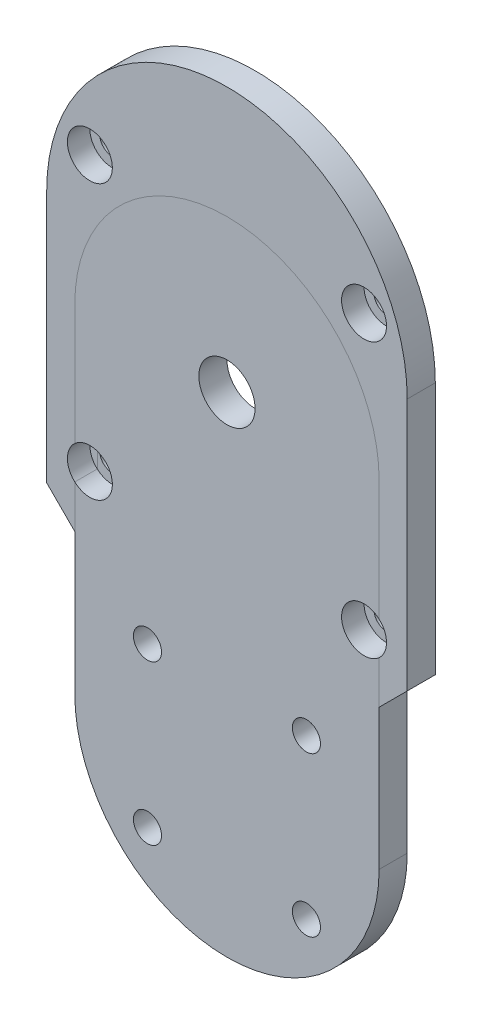
from build123d import *

# Parameters (mm, degrees)
BOSS_EXTRUDE1_DEPTH            = 5
SKETCH2_R                      = 2.5
CUT_EXTRUDE1_DEPTH             = 5
SKETCH3_R                      = 5
CUT_EXTRUDE2_DEPTH             = 5
BOSS_EXTRUDE2_DEPTH            = 5
CBORE_START                    = 1
CBORE_FOR_M4_SHCS1_OUTLINE_R   = 4
CBORE_FOR_M4_SHCS1_DEPTH       = 4
CBORE_FOR_M4_SHCS1_2_OUTLINE_R = 2.25
CBORE_FOR_M4_SHCS1_2_DEPTH     = 1


# Read off the part's stored shape, not the designer's step: CBORE for M4 SHCS1
with BuildPart() as part:
    # Sketch1 → Boss-Extrude1 (new body)
    with BuildSketch(Plane.XY):
        with BuildLine():
            Line((-27.08, 0), (-27.08, 60))
            ThreePointArc((-27.08, 60), (0, 87.08), (27.08, 60))
            Line((27.08, 60), (27.08, 0))
            ThreePointArc((27.08, 0), (0, -27.08), (-27.08, 0))
        make_face()
    extrude(amount=BOSS_EXTRUDE1_DEPTH)

    # Sketch2 → Cut-Extrude1 (cut)
    with BuildSketch(Plane.XY.offset(5)):
        with Locations((14.142135624, 14.142135624)):
            Circle(SKETCH2_R)
        with Locations((14.142135624, -14.142135624)):
            Circle(SKETCH2_R)
        with Locations((-14.142135624, -14.142135624)):
            Circle(SKETCH2_R)
        with Locations((-14.142135624, 14.142135624)):
            Circle(SKETCH2_R)
    extrude(amount=-CUT_EXTRUDE1_DEPTH, mode=Mode.SUBTRACT)

    # Sketch3 → Cut-Extrude2 (cut)
    with BuildSketch(Plane.XY.offset(5)):
        with Locations((0, 60)):
            Circle(SKETCH3_R)
    extrude(amount=-CUT_EXTRUDE2_DEPTH, mode=Mode.SUBTRACT)


with BuildPart() as body_2:
    # Sketch5 → Boss-Extrude2 (new body)
    with BuildSketch(Plane.XY.offset(5)):
        with BuildLine():
            Line((-32.08, 30), (-32.08, 75))
            ThreePointArc((-32.08, 75), (0, 107.08), (32.08, 75))
            Line((32.08, 75), (32.08, 30))
            Line((32.08, 30), (27.08, 25))
            Line((27.08, 25), (27.08, 60))
            ThreePointArc((27.08, 60), (0, 87.08), (-27.08, 60))
            Line((-27.08, 60), (-27.08, 25))
            Line((-27.08, 25), (-32.08, 30))
        make_face()
    extrude(amount=-BOSS_EXTRUDE2_DEPTH)


with BuildPart() as cbore_for_m4_shcs1_tool:
    # CBORE for M4 SHCS1 outline → CBORE for M4 SHCS1 (new body)
    with BuildSketch(Plane.XY.offset(CBORE_START)):
        with BuildLine():
            ThreePointArc((-27.08, 38.569906736), (-28.395183951, 35.604816049), (-27.08, 32.639725362))
            ThreePointArc((-27.08, 32.639725362), (-20.395183951, 35.604816049), (-27.08, 38.569906736))
        make_face()
        with BuildLine():
            ThreePointArc((27.08, 32.639725362), (28.395183951, 35.604816049), (27.08, 38.569906736))
            ThreePointArc((27.08, 38.569906736), (20.395183951, 35.604816049), (27.08, 32.639725362))
        make_face()
        with Locations((24.395183951, 84.395183951)):
            Circle(CBORE_FOR_M4_SHCS1_OUTLINE_R)
        with Locations((-24.395183951, 84.395183951)):
            Circle(CBORE_FOR_M4_SHCS1_OUTLINE_R)
    extrude(amount=CBORE_FOR_M4_SHCS1_DEPTH)


with BuildPart() as part_1:
    add(part.part)

    # CBORE for M4 SHCS1: cut by cbore_for_m4_shcs1_tool
    add(cbore_for_m4_shcs1_tool.part, mode=Mode.SUBTRACT)


with BuildPart() as body_2_1:
    add(body_2.part)

    # CBORE for M4 SHCS1: cut by cbore_for_m4_shcs1_tool
    add(cbore_for_m4_shcs1_tool.part, mode=Mode.SUBTRACT)


with BuildPart() as cbore_for_m4_shcs1_2_tool:
    # CBORE for M4 SHCS1 2 outline → CBORE for M4 SHCS1 2 (new body)
    with BuildSketch(Plane.XY):
        with Locations((24.395183951, 84.395183951)):
            Circle(CBORE_FOR_M4_SHCS1_2_OUTLINE_R)
        with Locations((-24.395183951, 84.395183951)):
            Circle(CBORE_FOR_M4_SHCS1_2_OUTLINE_R)
        with Locations((-24.395183951, 35.604816049)):
            Circle(CBORE_FOR_M4_SHCS1_2_OUTLINE_R)
        with Locations((24.395183951, 35.604816049)):
            Circle(CBORE_FOR_M4_SHCS1_2_OUTLINE_R)
    extrude(amount=CBORE_FOR_M4_SHCS1_2_DEPTH)


with BuildPart() as part_2:
    add(part_1.part)

    # CBORE for M4 SHCS1 2: cut by cbore_for_m4_shcs1_2_tool
    add(cbore_for_m4_shcs1_2_tool.part, mode=Mode.SUBTRACT)


with BuildPart() as body_2_2:
    add(body_2_1.part)

    # CBORE for M4 SHCS1 2: cut by cbore_for_m4_shcs1_2_tool
    add(cbore_for_m4_shcs1_2_tool.part, mode=Mode.SUBTRACT)


solid = Compound([part_2.part, body_2_2.part])
